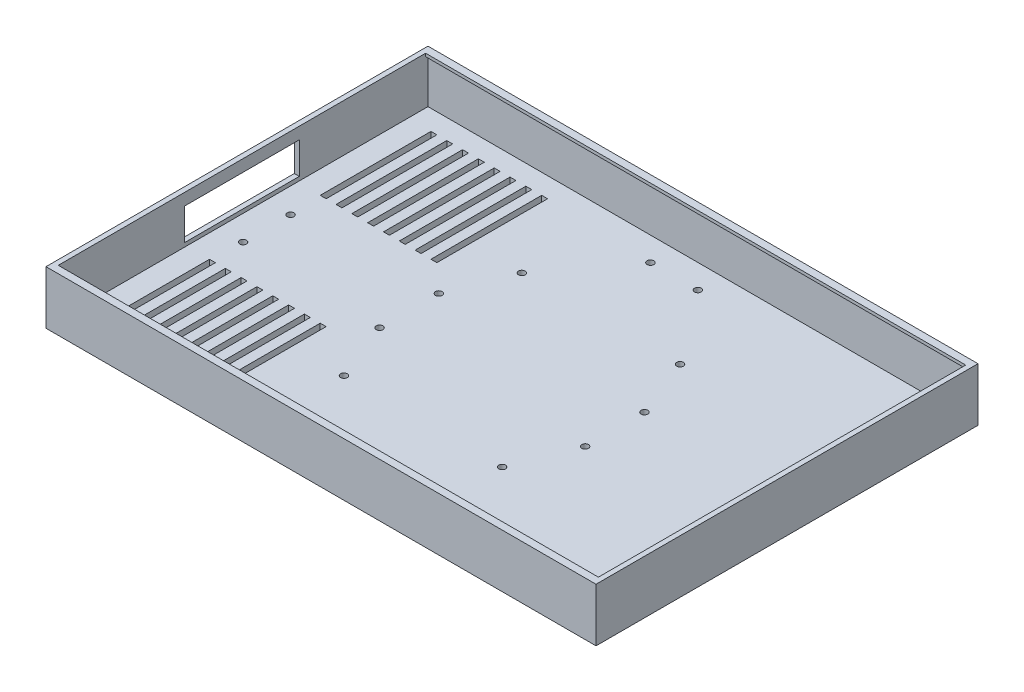
from build123d import *

# Parameters (mm, degrees)
SKETCH1_W                     = 278.2
SKETCH1_H                     = 193.2
SHELL_BLOCK_DEPTH             = 27
SKETCH2_W                     = 273.2
SKETCH2_H                     = 185.8
FRONT_OPENING_DEPTH           = 1.5
SKETCH3_W                     = 273.2
SKETCH3_H                     = 188.2
DISPLAY_POCKET_DEPTH          = 22.5
SKETCH4_W                     = 3
SKETCH4_H                     = 56
VENT_SLOTS_DEPTH              = 4
SKETCH5_W                     = 58
SKETCH5_H                     = 16
CABLE_EXIT_X_SHORT_SIDE_DEPTH = 140.1
SKETCH6_R                     = 1.7
BOLT_HOLES_DEPTH              = 4


with BuildPart() as part:
    # Sketch1 → Shell Block (new body)
    with BuildSketch(Plane(origin=(0, 0, 0), x_dir=(1, 0, 0), z_dir=(0, 1, 0))):
        Rectangle(SKETCH1_W, SKETCH1_H)
    extrude(amount=SHELL_BLOCK_DEPTH)

    # Sketch2 → Front Opening (cut)
    with BuildSketch(Plane(origin=(0, 27, 0), x_dir=(1, 0, 0), z_dir=(0, 1, 0))):
        Rectangle(SKETCH2_W, SKETCH2_H)
    extrude(amount=-FRONT_OPENING_DEPTH, mode=Mode.SUBTRACT)

    # Sketch3 → Display Pocket (cut)
    with BuildSketch(Plane(origin=(0, 25.5, 0), x_dir=(1, 0, 0), z_dir=(0, 1, 0))):
        Rectangle(SKETCH3_W, SKETCH3_H)
    extrude(amount=-DISPLAY_POCKET_DEPTH, mode=Mode.SUBTRACT)

    # Sketch4 → Vent Slots (cut)
    with BuildSketch(Plane(origin=(0, 3, 0), x_dir=(1, 0, 0), z_dir=(0, 1, 0))):
        with Locations((-67.5, 56)):
            Rectangle(SKETCH4_W, SKETCH4_H)
        with Locations((-67.5, -56)):
            Rectangle(SKETCH4_W, SKETCH4_H)
        with Locations((-75.5, 56)):
            Rectangle(SKETCH4_W, SKETCH4_H)
        with Locations((-75.5, -56)):
            Rectangle(SKETCH4_W, SKETCH4_H)
        with Locations((-83.5, 56)):
            Rectangle(SKETCH4_W, SKETCH4_H)
        with Locations((-83.5, -56)):
            Rectangle(SKETCH4_W, SKETCH4_H)
        with Locations((-91.5, 56)):
            Rectangle(SKETCH4_W, SKETCH4_H)
        with Locations((-91.5, -56)):
            Rectangle(SKETCH4_W, SKETCH4_H)
        with Locations((-99.5, 56)):
            Rectangle(SKETCH4_W, SKETCH4_H)
        with Locations((-99.5, -56)):
            Rectangle(SKETCH4_W, SKETCH4_H)
        with Locations((-107.5, 56)):
            Rectangle(SKETCH4_W, SKETCH4_H)
        with Locations((-107.5, -56)):
            Rectangle(SKETCH4_W, SKETCH4_H)
        with Locations((-115.5, 56)):
            Rectangle(SKETCH4_W, SKETCH4_H)
        with Locations((-115.5, -56)):
            Rectangle(SKETCH4_W, SKETCH4_H)
        with Locations((-123.5, 56)):
            Rectangle(SKETCH4_W, SKETCH4_H)
        with Locations((-123.5, -56)):
            Rectangle(SKETCH4_W, SKETCH4_H)
    extrude(amount=-VENT_SLOTS_DEPTH, mode=Mode.SUBTRACT)

    # Sketch5 → Cable Exit (-X short side) (cut)
    with BuildSketch(Plane(origin=(0, 0, 0), x_dir=(0, 0, -1), z_dir=(1, 0, 0))):
        with Locations((0, 13)):
            Rectangle(SKETCH5_W, SKETCH5_H)
    extrude(amount=-CABLE_EXIT_X_SHORT_SIDE_DEPTH, mode=Mode.SUBTRACT)

    # Sketch6 → Bolt Holes (cut)
    with BuildSketch(Plane(origin=(0, 3, 0), x_dir=(1, 0, 0), z_dir=(0, 1, 0))):
        with Locations((-40, -45)):
            Circle(SKETCH6_R)
        with Locations((-40, 45)):
            Circle(SKETCH6_R)
        with Locations((40, -45)):
            Circle(SKETCH6_R)
        with Locations((40, 45)):
            Circle(SKETCH6_R)
        with Locations((-52, -15)):
            Circle(SKETCH6_R)
        with Locations((-52, 15)):
            Circle(SKETCH6_R)
        with Locations((52, -15)):
            Circle(SKETCH6_R)
        with Locations((52, 15)):
            Circle(SKETCH6_R)
        with Locations((-12, -82)):
            Circle(SKETCH6_R)
        with Locations((-12, 82)):
            Circle(SKETCH6_R)
        with Locations((12, -82)):
            Circle(SKETCH6_R)
        with Locations((12, 82)):
            Circle(SKETCH6_R)
        with Locations((-124, -12)):
            Circle(SKETCH6_R)
        with Locations((-124, 12)):
            Circle(SKETCH6_R)
        with Locations((124, -12)):
            Circle(SKETCH6_R)
        with Locations((124, 12)):
            Circle(SKETCH6_R)
    extrude(amount=-BOLT_HOLES_DEPTH, mode=Mode.SUBTRACT)


solid = part.part
